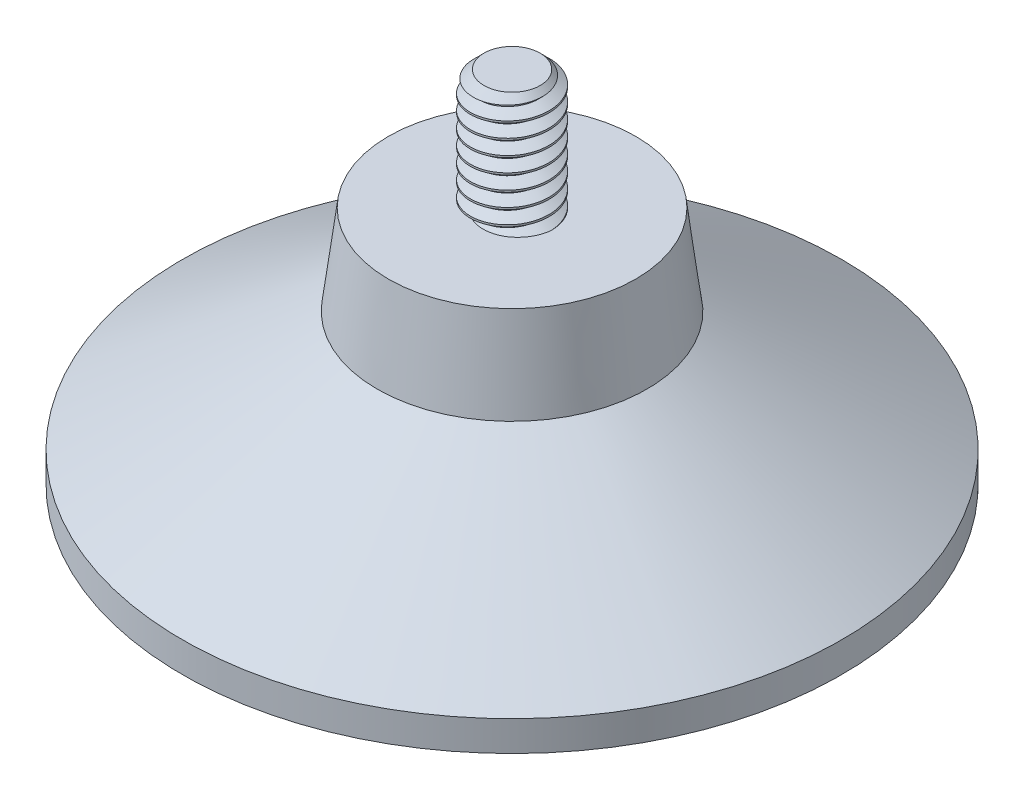
from build123d import *

# Parameters (mm, degrees)
SKETCH1_W        = 2.0828
SKETCH1_H        = 6.35
CHAMFER1_SIZE    = 0.5953125
CUT_SWEEP1_PITCH = 0.79375


with BuildPart() as part:
    # Sketch1 → Revolve1 (revolve)
    with BuildSketch(Plane.XY, mode=Mode.PRIVATE) as revolve1_sk:
        with Locations((1.0414, 15.875)):
            Rectangle(SKETCH1_W, SKETCH1_H)
    revolve(revolve1_sk.sketch.rotate(Axis((0, 12.7, 0), (0, 1, 0)), 90), axis=Axis((0, 12.7, 0), (0, 1, 0)))

    # Chamfer1
    chamfer1_edges = [part.edges().sort_by_distance(p)[0] for p in [
        (0, 19.05, 2.0828),
    ]]
    chamfer(chamfer1_edges, length=CHAMFER1_SIZE)

    # Cut-Sweep1: the profile of Sketch4 screwed along a right-hand helix of 9 turns, 8 arcs to a turn; built about Z, then put on its axis
    cut_sweep1_z = Axis((0, 0, 0), (0, 0, 1))
    cut_sweep1_corners = [(1.567244252, 0, -0.396875), (1.567244252, 0, -0.29765625), (2.1082, 0, 0.014664697), (2.1082, 0, -0.709195947)]
    with BuildLine(mode=Mode.PRIVATE) as cut_sweep1_profile:
        Line(cut_sweep1_corners[0], cut_sweep1_corners[1])
        Line(cut_sweep1_corners[1], cut_sweep1_corners[2])
        Line(cut_sweep1_corners[2], cut_sweep1_corners[3])
        Line(cut_sweep1_corners[3], cut_sweep1_corners[0])
    cut_sweep1_cap = Face(cut_sweep1_profile.wire())
    cut_sweep1_turn_angles = [0, 22.5, 45, 67.5, 90, 112.5, 135, 157.5, 180, 202.5, 225, 247.5, 270, 292.5, 315, 337.5, 360]
    cut_sweep1_turn_weights = [1, 0.9238795325112867, 1, 0.9238795325112867, 1, 0.9238795325112867, 1, 0.9238795325112867, 1, 0.9238795325112867, 1, 0.9238795325112867, 1, 0.9238795325112867, 1, 0.9238795325112867, 1]
    cut_sweep1_turn_rails = [Edge.make_bspline([Vector(p[0], p[1], 0).rotate(cut_sweep1_z, cut_sweep1_turn_angles[k]) / cut_sweep1_turn_weights[k] + Vector(0, 0, p[2] + CUT_SWEEP1_PITCH * cut_sweep1_turn_angles[k] / 360) for k in range(17)], [0, 0, 0, 1, 1, 2, 2, 3, 3, 4, 4, 5, 5, 6, 6, 7, 7, 8, 8, 8], 2, cut_sweep1_turn_weights) for p in cut_sweep1_corners]
    cut_sweep1_turn_sides = [Face.make_surface_from_curves(cut_sweep1_turn_rails[p[0]], cut_sweep1_turn_rails[p[1]]) for p in [(0, 1), (1, 2), (2, 3), (3, 0)]]
    cut_sweep1 = Plane(origin=(0, 19.05, 0), x_dir=(1, 0, 0), z_dir=(0, -1, 0)) * Solid(Shell([*[p.moved(Location((0, 0, CUT_SWEEP1_PITCH * i))) for i in range(9) for p in cut_sweep1_turn_sides], cut_sweep1_cap, cut_sweep1_cap.rotate(cut_sweep1_z, 3240).moved(Location((0, 0, CUT_SWEEP1_PITCH * 3240 / 360)))]))
    add(cut_sweep1, mode=Mode.SUBTRACT)

    # Sketch5 → Revolve2 (revolve)
    with BuildSketch(Plane.XY, mode=Mode.PRIVATE) as revolve2_sk:
        with BuildLine():
            Line((0, 6.35), (0, 12.7))
            Line((0, 12.7), (6.5532, 12.7))
            Line((6.5532, 12.7), (7.1501, 7.9502))
            Line((7.1501, 7.9502), (17.4625, 1.6002))
            Line((17.4625, 1.6002), (17.4625, 0))
            ThreePointArc((17.4625, 0), (10.387507615, 1.362519039), (4.324568966, 5.255172414))
            Line((4.324568966, 5.255172414), (3.175, 6.35))
            Line((3.175, 6.35), (0, 6.35))
        make_face()
    revolve(revolve2_sk.sketch.rotate(Axis((0, 0, 0), (0, 1, 0)), 90), axis=Axis((0, 0, 0), (0, 1, 0)))


solid = part.part
